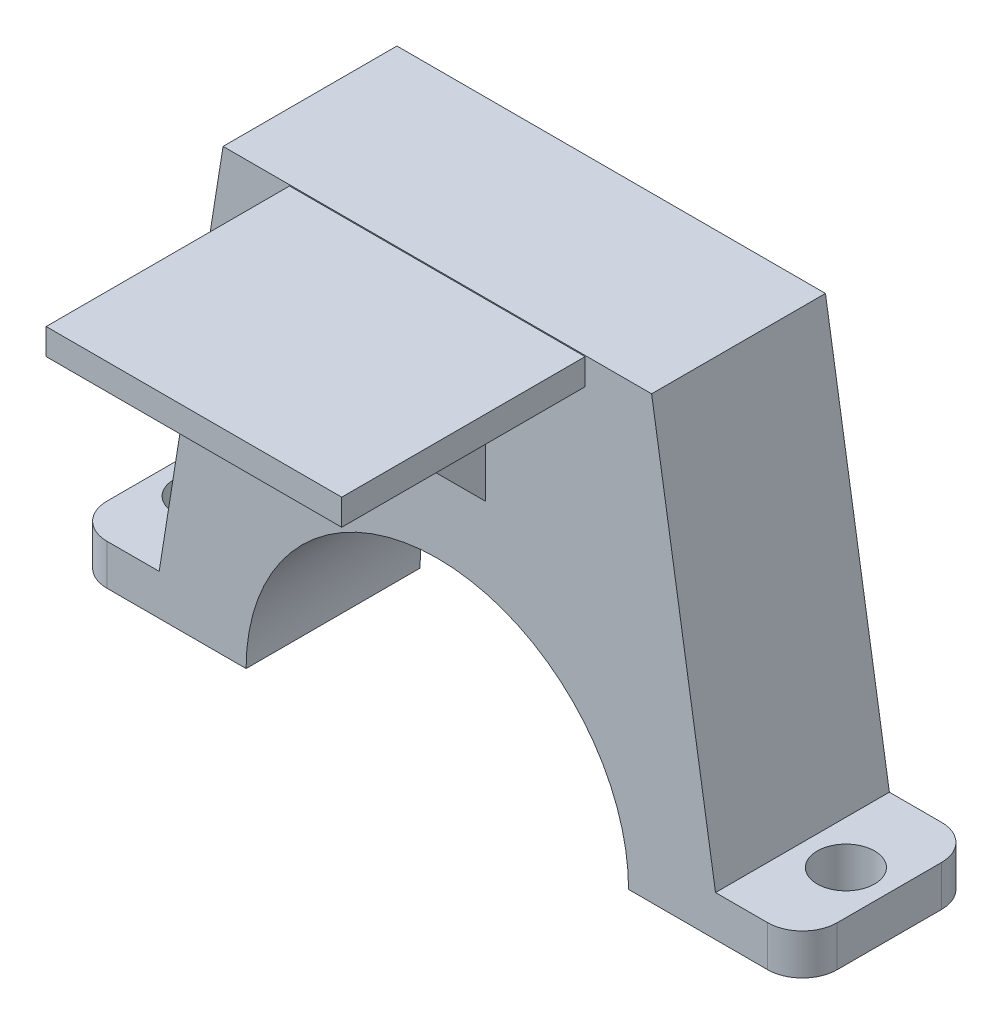
from build123d import *

# Parameters (mm, degrees)
BOSS_EXTRUDE1_DEPTH  = 10
SKETCH2_R            = 1.65
EXTERNAL_HOLES_DEPTH = 10
FILLET1_R            = 2
FILLET1_OF_MIRROR1_R = 2
SKETCH4_W            = 17
SKETCH4_H            = 1.5
BOSS_EXTRUDE2_DEPTH  = 14
SKETCH5_W            = 5.521728368
SKETCH5_H            = 8.571266928
BOSS_EXTRUDE3_DEPTH  = 10
CHAMFER1_SIZE        = 10


with BuildPart() as part:
    # Sketch1 → Boss-Extrude1 (new body)
    with BuildSketch(Plane.XY):
        with BuildLine():
            Line((-21, 0), (-11, 0))
            ThreePointArc((-11, 0), (-7.778174593, 7.778174593), (0, 11))
            Line((0, 11), (0, 16.170747429))
            Line((0, 16.170747429), (0, 25.35025486))
            Line((0, 25.35025486), (-12.324468849, 25.35025486))
            Line((-12.324468849, 25.35025486), (-16, 2.343730447))
            Line((-16, 2.343730447), (-21, 2.343730447))
            Line((-21, 2.343730447), (-21, 0))
        make_face()
    boss_extrude1 = extrude(amount=BOSS_EXTRUDE1_DEPTH)

    # Sketch2 → External_holes (cut)
    with BuildSketch(Plane(origin=(0, 2.343730447, 0), x_dir=(1, 0, 0), z_dir=(0, 1, 0))):
        with Locations(Location((-18.5, -5, 0), (0, 0, 180))):
            Circle(SKETCH2_R)
    external_holes = extrude(amount=-EXTERNAL_HOLES_DEPTH, mode=Mode.SUBTRACT)

    # Fillet1
    fillet1_edges = [part.edges().sort_by_distance(p)[0] for p in [
        (-21, 1.171865223, 10),
        (-21, 1.171865223, 0),
    ]]
    fillet(fillet1_edges, radius=FILLET1_R)

    # Mirror1: Boss-Extrude1, External_holes across Right Plane
    add(boss_extrude1.mirror(Plane(origin=(0, 0, 0), x_dir=(0, 0, -1), z_dir=(1, 0, 0))))
    add(external_holes.mirror(Plane(origin=(0, 0, 0), x_dir=(0, 0, -1), z_dir=(1, 0, 0))), mode=Mode.SUBTRACT)

    # Fillet1 of Mirror1
    fillet1_of_mirror1_edges = [part.edges().sort_by_distance(p)[0] for p in [
        (21, 1.171865223, 10),
        (21, 1.171865223, 0),
    ]]
    fillet(fillet1_of_mirror1_edges, radius=FILLET1_OF_MIRROR1_R)

    # Sketch4 → Boss-Extrude2 (add)
    with BuildSketch(Plane.XY.offset(10)):
        with Locations((0, 24.539717426)):
            Rectangle(SKETCH4_W, SKETCH4_H)
    extrude(amount=BOSS_EXTRUDE2_DEPTH)

    # Sketch5 → Boss-Extrude3 (add)
    with BuildSketch(Plane.XZ.offset(-23.789717426)):
        with Locations((0, 14.285633464)):
            Rectangle(SKETCH5_W, SKETCH5_H)
    extrude(amount=BOSS_EXTRUDE3_DEPTH)

    # Chamfer1
    # the kernel refuses this chamfer: 10 mm, written as the material it takes off along each edge
    with BuildSketch(Plane(origin=(-28.477694064, 13.789717426, 18.571266928), x_dir=(0, -0.027495876610586317, -0.9996219169112968), z_dir=(1, 0, 0))) as chamfer1_piece_1_section:
        Polygon((CHAMFER1_SIZE * 0.999621916911, CHAMFER1_SIZE * 0.0274958766106), (-CHAMFER1_SIZE * 0.0274958766106, CHAMFER1_SIZE * 0.999621916911), (0, 0), align=None)
    chamfer1_piece_1 = extrude(amount=56.955388128, mode=Mode.PRIVATE)
    chamfer1_piece_1 = split(chamfer1_piece_1, bisect_by=Plane(origin=(0, 17.174320664, 10), z_dir=(0, 0, 1)), keep=Keep.TOP, mode=Mode.PRIVATE)
    chamfer1_piece_1 = split(chamfer1_piece_1, bisect_by=Plane(origin=(0, 23.789717426, 15.454914499), z_dir=(0, -1, 0)), keep=Keep.TOP, mode=Mode.PRIVATE)
    add(chamfer1_piece_1, mode=Mode.SUBTRACT)


solid = part.part
